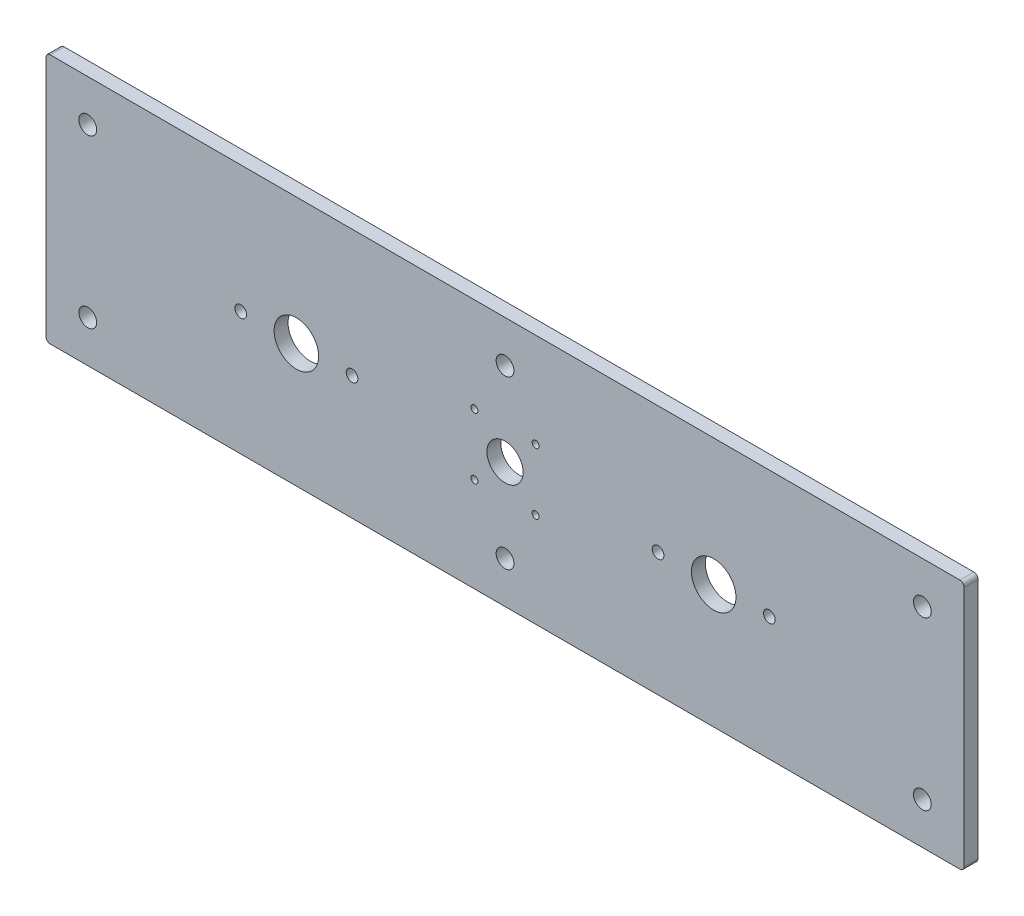
from build123d import *

# Parameters (mm, degrees)
SKETCH1_W                = 330
SKETCH1_H                = 90
BOSS_EXTRUDE1_DEPTH      = 2.5
M6_CLEARANCE_HOLE1_D     = 6.4
M6_CLEARANCE_HOLE1_DEPTH = 10
M6_CLEARANCE_HOLE1_TIP   = 1.922753981
SKETCH3_R                = 8
CUT_EXTRUDE2_DEPTH       = 172.099386323
M5X0_8_TAPPED_HOLE1_D    = 4.2
SKETCH4_R                = 6.5
CUT_EXTRUDE3_DEPTH       = 172.099386323
M3X0_5_TAPPED_HOLE1_D    = 2.5
FILLET1_R                = 1.5


with BuildPart() as part:
    # Sketch1 → Boss-Extrude1 (new, symmetric)
    with BuildSketch(Plane.XY):
        Rectangle(SKETCH1_W, SKETCH1_H)
    extrude(amount=BOSS_EXTRUDE1_DEPTH, both=True)

    # M6 Clearance Hole1
    with Locations(Plane.XY.offset(2.5)):
        with Locations((-150, 30), (-150, -30), (0, 30), (0, -30), (150, -30), (150, 30)):
            Hole(M6_CLEARANCE_HOLE1_D / 2, depth=M6_CLEARANCE_HOLE1_DEPTH)
            with Locations((0, 0, -(M6_CLEARANCE_HOLE1_DEPTH + M6_CLEARANCE_HOLE1_TIP / 2))):  # 118° drill point
                Cone(0, M6_CLEARANCE_HOLE1_D / 2, M6_CLEARANCE_HOLE1_TIP, mode=Mode.SUBTRACT)

    # Sketch3 → Cut-Extrude2 (cut, through all)
    with BuildSketch(Plane.XY.offset(2.5)):
        with Locations((-75, -0.6)):
            Circle(SKETCH3_R)
    cut_extrude2 = extrude(amount=-CUT_EXTRUDE2_DEPTH, mode=Mode.SUBTRACT)

    # M5x0.8 Tapped Hole1 (through all)
    with Locations(Plane.XY.offset(2.5)):
        with Locations((-95, -0.6), (-55, -0.6)):
            m5x0_8_tapped_hole1 = Hole(M5X0_8_TAPPED_HOLE1_D / 2)

    # Mirror1: Cut-Extrude2, M5x0.8 Tapped Hole1 across plane
    add(cut_extrude2.mirror(Plane(origin=(0, 0, 0), x_dir=(0, 0, 1), z_dir=(1, 0, 0))), mode=Mode.SUBTRACT)
    add(m5x0_8_tapped_hole1.mirror(Plane(origin=(0, 0, 0), x_dir=(0, 0, 1), z_dir=(1, 0, 0))), mode=Mode.SUBTRACT)

    # Sketch4 → Cut-Extrude3 (cut, through all)
    with BuildSketch(Plane.XY.offset(2.5)):
        Circle(SKETCH4_R)
    extrude(amount=-CUT_EXTRUDE3_DEPTH, mode=Mode.SUBTRACT)

    # M3x0.5 Tapped Hole1 (through all)
    with Locations(Plane.XY.offset(2.5)):
        with Locations((11, 11), (-11, -11), (-11, 11), (11, -11)):
            Hole(M3X0_5_TAPPED_HOLE1_D / 2)

    # Fillet1
    fillet1_edges = [part.edges().sort_by_distance(p)[0] for p in [
        (-165, -45, 0),
        (-165, 45, 0),
        (165, -45, 0),
        (165, 45, 0),
    ]]
    fillet(fillet1_edges, radius=FILLET1_R)


solid = part.part
